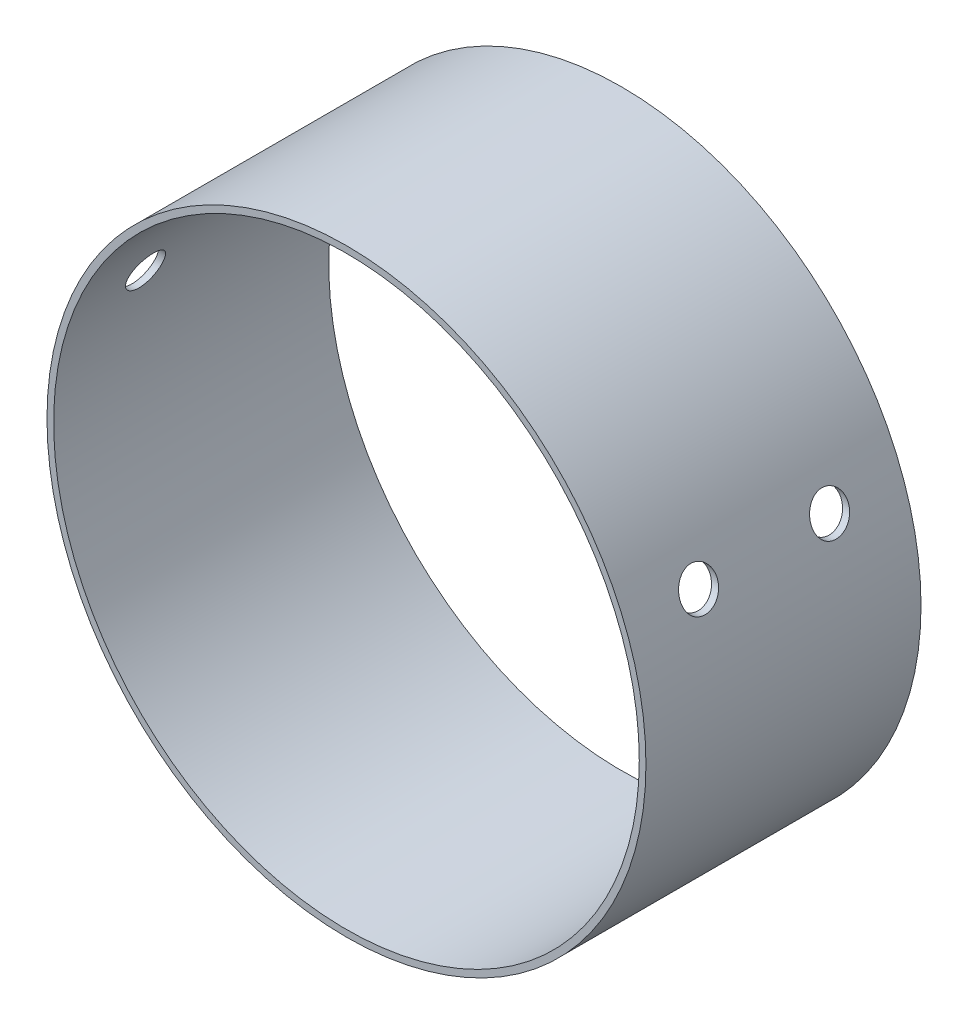
from build123d import *

# Parameters (mm, degrees)
SKETCH1_R               = 50.8
SKETCH1_R_2             = 49.6697
BOSS_EXTRUDE1_DEPTH     = 23.3299
CUT_EXTRUDE1_DEPTH      = 76.535185404
CUT_EXTRUDE1_DEPTH_BACK = 76.535185404
SKETCH2_R               = 3.175


with BuildPart() as part:
    # Sketch1 → Boss-Extrude1 (new, symmetric)
    with BuildSketch(Plane.XY):
        Circle(SKETCH1_R)
        Circle(SKETCH1_R_2, mode=Mode.SUBTRACT)
    extrude(amount=BOSS_EXTRUDE1_DEPTH, both=True)

    # Sketch2 → Cut-Extrude1 (cut, two sides: drawn at the far end of the back side and taken through both)
    with BuildSketch(Plane(origin=(0, 0, 0), x_dir=(0, 0, -1), z_dir=(1, 0, 0)).offset(-CUT_EXTRUDE1_DEPTH_BACK)):
        with Locations((-11.1125, 17.93748)):
            Circle(SKETCH2_R)
        with Locations((11.1125, 17.93748)):
            Circle(SKETCH2_R)
    extrude(amount=CUT_EXTRUDE1_DEPTH + CUT_EXTRUDE1_DEPTH_BACK, mode=Mode.SUBTRACT)


solid = part.part
